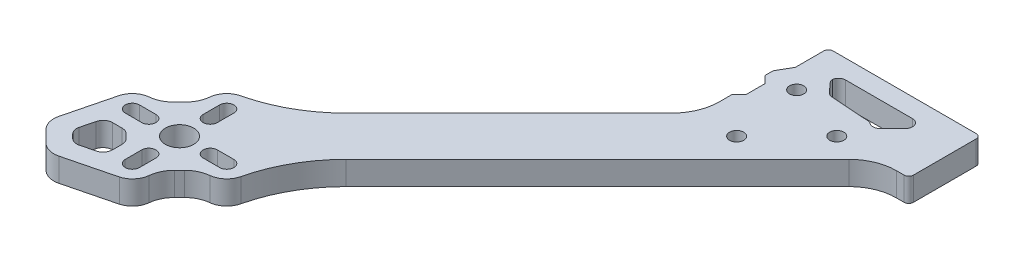
from build123d import *

# Parameters (mm, degrees)
SKETCH2_R           = 3.0000000000000018
SKETCH2_R_2         = 1.4999999999993736
SKETCH2_R_3         = 1.5000000000000009
SKETCH2_R_4         = 1.4999999999993723
BOSS_EXTRUDE1_DEPTH = 5
FILLET1_R           = 1.5
FILLET3_R           = 10
FILLET5_R           = 10
CHAMFER1_SIZE       = 4.5
FILLET6_R           = 6
FILLET7_R           = 4
FILLET8_R           = 2
FILLET9_R           = 30
CUT_EXTRUDE1_DEPTH  = 142.21634167657882
FILLET10_R          = 1


with BuildPart() as part:
    # Sketch2 → Boss-Extrude1 (new body)
    with BuildSketch(Plane(origin=(0, 0, 0), x_dir=(1, 0, 0), z_dir=(0, 1, 0))):
        with BuildLine():
            Line((-46.189355852298796, -96.42025186017804), (-39.496927389393186, -89.72782339727232))
            Line((-39.496927389393186, -89.72782339727232), (17.913506363615255, -32.31738964426288))
            Line((17.913506363615255, -32.31738964426288), (24.678224989376695, -32.31738964426288))
            Line((24.678224989376695, -32.31738964426288), (24.678224989376428, -17.06738964426295))
            Line((24.678224989376428, -17.06738964426295), (-7.595965049770856, -17.06738964426337))
            Line((-7.595965049770856, -17.06738964426337), (-7.595965049770857, -24.067389644263372))
            Line((-7.595965049770857, -24.067389644263372), (-9.321775010623746, -27.06012368042446))
            Line((-9.321775010623746, -27.06012368042446), (-9.32177501062375, -37.06738964426337))
            Line((-9.32177501062375, -37.06738964426337), (-9.321775010623757, -42.58210827002507))
            Line((-9.321775010623753, -42.58210827002507), (-54.6598701272448, -87.9202033866469))
            Line((-54.6598701272448, -87.9202033866469), (-60.17458875300816, -87.92020338664692))
            ThreePointArc((-60.17458875300816, -87.92020338664692), (-63.00301587775435, -89.09177626190073), (-64.17458875300817, -91.92020338664692))
            Line((-64.17458875300817, -91.92020338664692), (-64.17458875300817, -97.92020338664689))
            Line((-64.17458875300817, -97.92020338664689), (-70.17458875301077, -97.92020338664689))
            ThreePointArc((-70.17458875301077, -97.92020338664689), (-72.6339398041774, -98.76558892412923), (-74.05374095021992, -100.9444071830841))
            Line((-74.05374095021992, -100.9444071830841), (-77.14515150148509, -113.23391188563446))
            Line((-77.14515150148509, -113.23391188563446), (-71.4882972519927, -118.89076613512684))
            Line((-71.4882972519927, -118.89076613512684), (-59.047429208957894, -115.75810794021132))
            ThreePointArc((-59.047429208957894, -115.75810794021132), (-56.9723521770992, -114.3172183869977), (-56.174588753010745, -111.92020338664949))
            Line((-56.174588753010745, -111.92020338664949), (-56.174588753010745, -105.92020338664949))
            Line((-56.174588753010745, -105.92020338664949), (-50.174588753008145, -105.92020338664949))
            ThreePointArc((-50.174588753008145, -105.92020338664949), (-47.34616162826196, -104.74863051139567), (-46.174588753008145, -101.92020338664949))
            Line((-46.174588753008145, -101.92020338664949), (-46.17464642427909, -101.89872393503671))
            Line((-46.17464642427909, -101.89872393503671), (-46.189355852298796, -96.42025186017804))
        make_face()
        Polygon((-70.26446914062754, -114.4577399969996), (-72.71257361922765, -112.00963551839949), (-71.33075600396296, -106.51639746436214), (-66.89210317428027, -106.51639746436214), (-64.77078283072062, -108.63771780792177), (-64.7707828307206, -113.0744087552009), align=None, mode=Mode.SUBTRACT)
        with BuildLine():
            ThreePointArc((-61.67458875301074, -108.42020338664949), (-60.17458875301075, -106.92020338664949), (-58.67458875301077, -108.42020338664949))
            Line((-58.67458875301077, -108.42020338664949), (-58.674588753010774, -111.92020338664949))
            ThreePointArc((-58.674588753010774, -111.92020338664949), (-60.17458875301075, -113.42020338664946), (-61.67458875301073, -111.92020338664949))
            Line((-61.67458875301073, -111.92020338664949), (-61.67458875301074, -108.42020338664949))
        make_face(mode=Mode.SUBTRACT)
        with BuildLine():
            ThreePointArc((-66.67458875301074, -100.42020338664692), (-65.17458875301071, -101.92020338664692), (-66.67458875301074, -103.42020338664692))
            Line((-66.67458875301074, -103.42020338664692), (-70.17458875301077, -103.42020338664692))
            ThreePointArc((-70.17458875301077, -103.42020338664692), (-71.67458875301075, -101.92020338664692), (-70.17458875301077, -100.42020338664692))
            Line((-70.17458875301077, -100.4202033866469), (-66.67458875301074, -100.4202033866469))
        make_face(mode=Mode.SUBTRACT)
        with Locations(Location((-60.174588753008145, -101.92020338664949, 0), (0, 0, 270))):
            Circle(SKETCH2_R, mode=Mode.SUBTRACT)
        with BuildLine():
            ThreePointArc((-53.67458875300815, -103.42020338664949), (-55.17458875300815, -101.92020338664949), (-53.67458875300815, -100.42020338664949))
            Line((-53.67458875300815, -100.42020338664949), (-50.174588753008145, -100.42020338664949))
            ThreePointArc((-50.174588753008145, -100.42020338664949), (-48.67458875300816, -101.92020338664949), (-50.174588753008145, -103.42020338664949))
            Line((-50.174588753008145, -103.42020338664949), (-53.67458875300815, -103.42020338664949))
        make_face(mode=Mode.SUBTRACT)
        with BuildLine():
            ThreePointArc((-58.67458875300815, -95.42020338664692), (-60.17458875300815, -96.9202033866469), (-61.67458875300815, -95.42020338664692))
            Line((-61.674588753008145, -95.42020338664692), (-61.67458875300816, -91.92020338664692))
            ThreePointArc((-61.67458875300816, -91.92020338664692), (-60.174588753008145, -90.42020338664689), (-58.67458875300813, -91.92020338664692))
            Line((-58.67458875300813, -91.92020338664692), (-58.674588753008145, -95.42020338664692))
        make_face(mode=Mode.SUBTRACT)
        with Locations(Location((-1.1783767284213562, -42.92399136206118, 0), (0, 0, 270))):
            Circle(SKETCH2_R_2, mode=Mode.SUBTRACT)
        with Locations(Location((-3.3217750106237407, -28.067389644263372, 0), (0, 0, 270))):
            Circle(SKETCH2_R_3, mode=Mode.SUBTRACT)
        with Locations(Location((9.428224989376764, -32.31738964426288, 0), (0, 0, 270))):
            Circle(SKETCH2_R_4, mode=Mode.SUBTRACT)
        Polygon((1.0820753752795897, -25.575281589539195), (-1.459873180493811, -22.79599601598655), (-1.4598731804937872, -21.06738964426295), (17.849797864630506, -21.06738964426295), (11.740910030340089, -27.17627747855337), (10.272484798754686, -26.22755837455273), align=None, mode=Mode.SUBTRACT)
    extrude(amount=BOSS_EXTRUDE1_DEPTH)

    # Fillet1
    # the kernel refuses this fillet: 1.5 mm, written as the material it adds along each edge
    with BuildSketch(Plane(origin=(1.0820753752795897, 0, 25.575281589539195), x_dir=(0.9974908468725838, 0, 0.07079555357093803), z_dir=(0, 1, 0))) as fillet1_piece_1:
        with BuildLine():
            CenterArc((FILLET1_R * 0.398900109333, FILLET1_R), FILLET1_R, 226.50587582859146, 43.4941241714086)
            Line((-FILLET1_R * 0.289380073746, FILLET1_R * 0.274555040282), (0, 0))
            Line((0, 0), (FILLET1_R * 0.398900109333, 0))
        make_face()
    extrude(amount=5)
    with BuildSketch(Plane(origin=(-1.459873180493811, 0, 22.79599601598655), x_dir=(1.372e-14, 0, -1), z_dir=(0, 1, 0))) as fillet1_piece_2:
        with BuildLine():
            CenterArc((FILLET1_R * 0.388338270451, -FILLET1_R), FILLET1_R, 89.99999999999997, 42.44619337739144)
            Line((-FILLET1_R * 0.286559260205, -FILLET1_R * 0.262088539786), (0, 0))
            Line((0, 0), (FILLET1_R * 0.388338270451, 0))
        make_face()
    extrude(amount=5)
    with BuildSketch(Plane(origin=(-1.459873180493787, 0, 21.06738964426295), x_dir=(1, 0, 0), z_dir=(0, 1, 0))) as fillet1_piece_3:
        with BuildLine():
            CenterArc((FILLET1_R, -FILLET1_R), FILLET1_R, 90, 89.99999999999918)
            Line((-2.087e-14, -FILLET1_R), (0, 0))
            Line((0, 0), (FILLET1_R, 0))
        make_face()
    extrude(amount=5)
    with BuildSketch(Plane(origin=(11.740910030340089, 0, 27.17627747855337), x_dir=(-0.839945220222329, 0, -0.5426711960530642), z_dir=(0, 1, 0))) as fillet1_piece_4:
        with BuildLine():
            CenterArc((FILLET1_R * 0.807844840446, -FILLET1_R), FILLET1_R, 89.99999999999994, 77.86566453571226)
            Line((-FILLET1_R * 0.169812603282, -FILLET1_R * 0.789795521639), (0, 0))
            Line((0, 0), (FILLET1_R * 0.807844840446, -3e-17))
        make_face()
    extrude(amount=5)
    with BuildSketch(Plane(origin=(17.849797864630506, 0, 21.06738964426295), x_dir=(-0.7071067811865475, 0, 0.7071067811865475), z_dir=(0, 1, 0))) as fillet1_piece_5:
        with BuildLine():
            CenterArc((FILLET1_R * 2.41421356237, -FILLET1_R), FILLET1_R, 89.99999999999994, 135.00000000000006)
            Line((FILLET1_R * 1.70710678119, -FILLET1_R * 1.70710678119), (0, 0))
            Line((0, 0), (FILLET1_R * 2.41421356237, 1e-17))
        make_face()
    extrude(amount=5)
    # the kernel refuses this fillet: 1.5 mm, written as the material it takes off along each edge
    with BuildSketch(Plane(origin=(10.27248479875469, -0.9630450228974294, 26.22755837455273), x_dir=(0.8399452202223279, 0, 0.5426711960530661), z_dir=(0, 1, 0))) as fillet1_2_piece_1:
        with BuildLine():
            CenterArc((FILLET1_R * 0.256812006106, -FILLET1_R), FILLET1_R, 90.00000000000006, 28.805982084511456)
            Line((-FILLET1_R * 0.225033157983, -FILLET1_R * 0.123743623222), (0, 0))
            Line((0, 0), (FILLET1_R * 0.256812006106, 2e-17))
        make_face()
    extrude(amount=6.92609004579486, mode=Mode.SUBTRACT)

    # Fillet3
    fillet3_edges = [part.edges().sort_by_distance(p)[0] for p in [
        (17.913506363615255, 2.5, 32.31738964426288),
    ]]
    fillet(fillet3_edges, radius=FILLET3_R)

    # Fillet5
    fillet5_edges = [part.edges().sort_by_distance(p)[0] for p in [
        (-9.321775010623755, 2.5, 42.58210827002507),
    ]]
    fillet(fillet5_edges, radius=FILLET5_R)

    # Chamfer1
    chamfer1_edges = [part.edges().sort_by_distance(p)[0] for p in [
        (-64.17458875300817, 2.5, 97.92020338664689),
        (-56.174588753010745, 2.5, 105.92020338664949),
    ]]
    chamfer(chamfer1_edges, length=CHAMFER1_SIZE)

    # Fillet6
    fillet6_edges = [part.edges().sort_by_distance(p)[0] for p in [
        (-64.17458875300817, 2.5, 93.42020338664689),
        (-68.67458875300817, 2.5, 97.92020338664689),
        (-56.174588753010745, 2.5, 110.42020338664949),
        (-51.674588753010745, 2.5, 105.92020338664949),
    ]]
    fillet(fillet6_edges, radius=FILLET6_R)

    # Fillet7
    fillet7_edges = [part.edges().sort_by_distance(p)[0] for p in [
        (-71.4882972519927, 2.5, 118.89076613512684),
        (-77.14515150148509, 2.5, 113.23391188563446),
    ]]
    fillet(fillet7_edges, radius=FILLET7_R)

    # Fillet8
    fillet8_edges = [part.edges().sort_by_distance(p)[0] for p in [
        (-72.71257361922765, 2.5, 112.00963551839949),
        (-70.26446914062754, 2.5, 114.4577399969996),
        (-64.7707828307206, 2.5, 113.0744087552009),
        (-64.77078283072062, 2.5, 108.63771780792177),
        (-66.89210317428027, 2.5, 106.51639746436214),
        (-71.33075600396296, 2.5, 106.51639746436214),
    ]]
    fillet(fillet8_edges, radius=FILLET8_R)

    # Fillet9
    fillet9_edges = [part.edges().sort_by_distance(p)[0] for p in [
        (-54.6598701272448, 2.5, 87.9202033866469),
        (-46.189355852298796, 2.5, 96.42025186017804),
    ]]
    fillet(fillet9_edges, radius=FILLET9_R)

    # Sketch4 → Cut-Extrude1 (cut, through all)
    with BuildSketch(Plane(origin=(0, 5, 0), x_dir=(1, 0, 0), z_dir=(0, 1, 0))):
        Polygon((-9.321775010623751, -28.81997264629415), (-7.82177501062375, -30.31997264629416), (-7.821775010623751, -34.31997264629416), (-9.321775010623751, -35.819972646294175), align=None)
    extrude(amount=-CUT_EXTRUDE1_DEPTH, mode=Mode.SUBTRACT)

    # Fillet10
    fillet10_edges = [part.edges().sort_by_distance(p)[0] for p in [
        (-7.595965049770856, 2.5, 17.06738964426337),
        (24.678224989376428, 2.5, 17.06738964426295),
        (24.678224989376695, 2.5, 32.31738964426288),
    ]]
    fillet(fillet10_edges, radius=FILLET10_R)


solid = part.part
